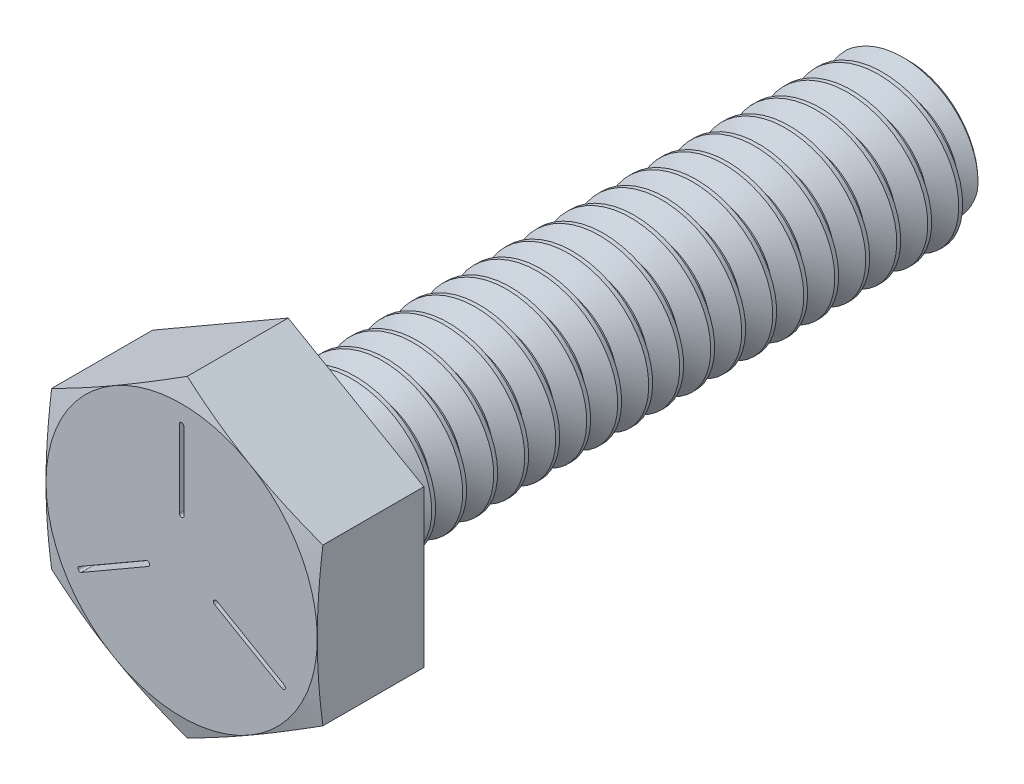
from build123d import *

# Parameters (mm, degrees)
BOSS_EXTRUDE1_DEPTH = 4.365625
SKETCH5_OUTSIDE_W   = 258.458
SKETCH5_OUTSIDE_H   = 260.178
SKETCH5_OUTSIDE_R   = 5.55625
CUT_EXTRUDE1_DEPTH  = 31.952009592
CUT_EXTRUDE1_DRAFT  = -75
CUT_SWEEP1_PITCH    = 1.27
CUT_SWEEP1_TO       = 25.4
CUT_EXTRUDE2_DEPTH  = 0.508


with BuildPart() as part:
    # Sketch3 → Revolve1 (revolve)
    with BuildSketch(Plane(origin=(0, 0, 0), x_dir=(0, 0, -1), z_dir=(1, 0, 0)), mode=Mode.PRIVATE) as revolve1_sk:
        Polygon((0, 5.55625), (-4.365625, 5.55625), (-4.365625, 0), (25.4, 0), (25.4, 2.8575), (25.0825, 3.175), (0, 3.175), align=None)
    revolve(revolve1_sk.sketch.rotate(Axis((0, 0, 4.365625), (0, 0, -1)), 180), axis=Axis((0, 0, 4.365625), (0, 0, -1)))

    # Sketch4 → Boss-Extrude1 (add)
    with BuildSketch(Plane.XY):
        Polygon((0, 6.415804866), (-5.55625, 3.207902433), (-5.55625, -3.207902433), (0, -6.415804866), (5.55625, -3.207902433), (5.55625, 3.207902433), align=None)
    extrude(amount=BOSS_EXTRUDE1_DEPTH)


with BuildPart() as cut_extrude1_tool:
    # Sketch5 outside → Cut-Extrude1 (with draft: the straight prism first)
    with BuildSketch(Plane.XY.offset(4.365625)):
        Rectangle(SKETCH5_OUTSIDE_W, SKETCH5_OUTSIDE_H)
        Circle(SKETCH5_OUTSIDE_R, mode=Mode.SUBTRACT)
    extrude(amount=-CUT_EXTRUDE1_DEPTH)
    # Cut-Extrude1: the draft: its side faces are tilted about the plane it starts from
    cut_extrude1_sides = [cut_extrude1_tool.faces().sort_by_distance(p)[0] for p in [
        (0, -130.089, -11.610379796),
        (129.229, 0, -11.610379796),
        (0, 130.089, -11.610379796),
        (-129.229, 0, -11.610379796),
        (-5.55625, 0, -11.610379796),
    ]]
    draft(cut_extrude1_sides, Plane.XY.offset(4.365625), CUT_EXTRUDE1_DRAFT)


with BuildPart() as part_1:
    add(part.part)

    # Cut-Extrude1: cut by cut_extrude1_tool
    add(cut_extrude1_tool.part, mode=Mode.SUBTRACT)


with BuildPart() as body_2:
    # Split1: read off the stored shape, not the designer's step
    # Split1: the piece on the far side of the plane
    add(part_1.part)
    split(bisect_by=Plane.XY, keep=Keep.BOTTOM)

    # Cut-Sweep1: arcs per turn and ends read off the stored shape
    # Cut-Sweep1: the profile of Sketch8 screwed along a right-hand helix through 21 turns, 8 arcs to a turn; built about Z, then put on its axis
    cut_sweep1_z = Axis((0, 0, 0), (0, 0, 1))
    cut_sweep1_corners = [(3.312481533, 0, 0.079375), (3.243740766, 0, -1.1509375), (2.350110803, 0, -0.635), (2.350110803, 0, -0.47625)]
    with BuildLine(mode=Mode.PRIVATE) as cut_sweep1_profile:
        Line(cut_sweep1_corners[0], cut_sweep1_corners[1])
        Line(cut_sweep1_corners[1], cut_sweep1_corners[2])
        Line(cut_sweep1_corners[2], cut_sweep1_corners[3])
        Line(cut_sweep1_corners[3], cut_sweep1_corners[0])
    cut_sweep1_cap = Face(cut_sweep1_profile.wire())
    cut_sweep1_turn_angles = [0, 22.5, 45, 67.5, 90, 112.5, 135, 157.5, 180, 202.5, 225, 247.5, 270, 292.5, 315, 337.5, 360]
    cut_sweep1_turn_weights = [1, 0.9238795325112867, 1, 0.9238795325112867, 1, 0.9238795325112867, 1, 0.9238795325112867, 1, 0.9238795325112867, 1, 0.9238795325112867, 1, 0.9238795325112867, 1, 0.9238795325112867, 1]
    cut_sweep1_turn_rails = [Edge.make_bspline([Vector(p[0], p[1], 0).rotate(cut_sweep1_z, cut_sweep1_turn_angles[k]) / cut_sweep1_turn_weights[k] + Vector(0, 0, p[2] + CUT_SWEEP1_PITCH * cut_sweep1_turn_angles[k] / 360) for k in range(17)], [0, 0, 0, 1, 1, 2, 2, 3, 3, 4, 4, 5, 5, 6, 6, 7, 7, 8, 8, 8], 2, cut_sweep1_turn_weights) for p in cut_sweep1_corners]
    cut_sweep1_turn_sides = [Face.make_surface_from_curves(cut_sweep1_turn_rails[p[0]], cut_sweep1_turn_rails[p[1]]) for p in [(0, 1), (1, 2), (2, 3), (3, 0)]]
    cut_sweep1 = Plane(origin=(0, 0, -25.4), x_dir=(0, 1, 0), z_dir=(0, 0, 1)) * split(Solid(Shell([*[p.moved(Location((0, 0, CUT_SWEEP1_PITCH * i))) for i in range(21) for p in cut_sweep1_turn_sides], cut_sweep1_cap, cut_sweep1_cap.rotate(cut_sweep1_z, 7560).moved(Location((0, 0, CUT_SWEEP1_PITCH * 7560 / 360)))])), bisect_by=Plane.XY.offset(CUT_SWEEP1_TO), keep=Keep.BOTTOM, mode=Mode.PRIVATE)
    add(cut_sweep1, mode=Mode.SUBTRACT)


with BuildPart() as part_2:
    add(part_1.part)

    # Split1
    split(bisect_by=Plane.XY, keep=Keep.TOP)

    # Combine1: union body 2
    add(body_2.part)

    # Sketch6 → Cut-Extrude2 (cut)
    with BuildSketch(Plane.XY.offset(4.365625)):
        with BuildLine():
            Line((-0.09525, 1.620402433), (-0.09525, 4.795402433))
            ThreePointArc((-0.09525, 4.795402433), (0, 4.890652433), (0.09525, 4.795402433))
            Line((0.09525, 4.795402433), (0.09525, 1.620402433))
            ThreePointArc((0.09525, 1.620402433), (0, 1.525152433), (-0.09525, 1.620402433))
        make_face()
        with BuildLine():
            Line((1.450934671, -0.727712297), (4.200565329, -2.315212297))
            ThreePointArc((4.200565329, -2.315212297), (4.235429248, -2.445326217), (4.105315329, -2.480190136))
            Line((4.105315329, -2.480190136), (1.355684671, -0.892690136))
            ThreePointArc((1.355684671, -0.892690136), (1.320820752, -0.762576217), (1.450934671, -0.727712297))
        make_face()
        with BuildLine():
            Line((-1.355684671, -0.892690136), (-4.105315329, -2.480190136))
            ThreePointArc((-4.105315329, -2.480190136), (-4.235429248, -2.445326217), (-4.200565329, -2.315212297))
            Line((-4.200565329, -2.315212297), (-1.450934671, -0.727712297))
            ThreePointArc((-1.450934671, -0.727712297), (-1.320820752, -0.762576217), (-1.355684671, -0.892690136))
        make_face()
    extrude(amount=-CUT_EXTRUDE2_DEPTH, mode=Mode.SUBTRACT)


solid = part_2.part
